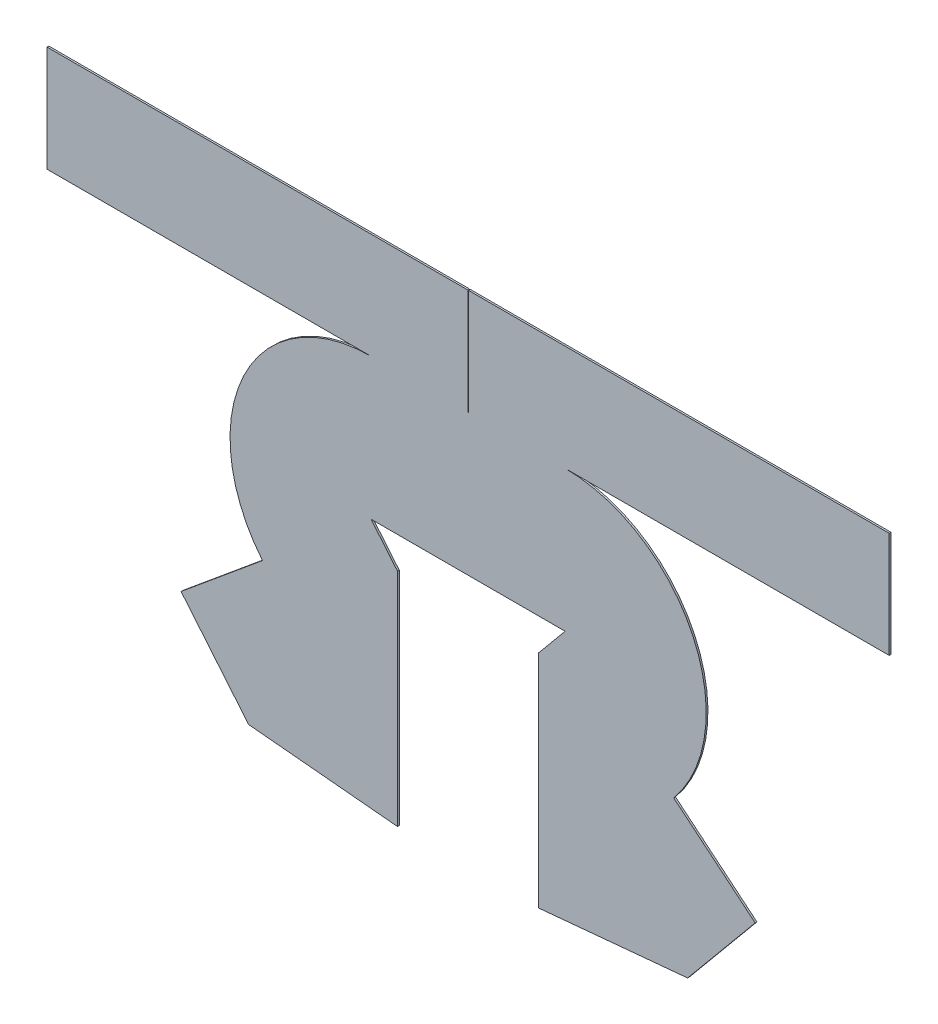
from build123d import *

# Parameters (mm, degrees)
BOSS_EXTRUDE2_DEPTH = 2.54
SKETCH2_W           = 0.79375
SKETCH2_H           = 152.4
CUT_EXTRUDE1_DEPTH  = 55.525399461


with BuildPart() as part:
    # Sketch1 → Boss-Extrude2 (new body)
    with BuildSketch(Plane.XY):
        with BuildLine():
            ThreePointArc((437.202610799, 39.476614679), (464.676131123, 255.58711032), (280.770009641, 372.365015451))
            Line((280.770009641, 372.365015451), (747.609563641, 372.365015451))
            Line((747.609563641, 372.365015451), (747.609563641, 524.765015451))
            Line((747.609563641, 524.765015451), (-465.469544359, 524.765015451))
            Line((-465.469544359, 524.765015451), (-465.469544359, 372.365015451))
            Line((-465.469544359, 372.365015451), (1.370009641, 372.365015451))
            ThreePointArc((1.370009641, 372.365015451), (-182.536111841, 255.58711032), (-155.062591517, 39.476614679))
            Line((-155.062591517, 39.476614679), (-272.387042386, -57.7896859))
            Line((-272.387042386, -57.7896859), (-175.120741807, -175.114136769))
            Line((-175.120741807, -175.114136769), (39.470009641, -195.172287059))
            Line((39.470009641, -195.172287059), (39.470009641, 123.208075057))
            Line((39.470009641, 123.208075057), (1.370009641, 169.165015451))
            Line((1.370009641, 169.165015451), (280.770009641, 169.165015451))
            Line((280.770009641, 169.165015451), (242.670009641, 123.208075057))
            Line((242.670009641, 123.208075057), (242.670009641, -195.172287059))
            Line((242.670009641, -195.172287059), (457.260761089, -175.114136769))
            Line((457.260761089, -175.114136769), (554.527061668, -57.7896859))
            Line((554.527061668, -57.7896859), (437.202610799, 39.476614679))
        make_face()
    extrude(amount=BOSS_EXTRUDE2_DEPTH)

    # Sketch2 → Cut-Extrude1 (cut)
    with BuildSketch(Plane.XY.offset(2.54)):
        with Locations((141.070009641, 448.565015451)):
            Rectangle(SKETCH2_W, SKETCH2_H)
    extrude(amount=-CUT_EXTRUDE1_DEPTH, mode=Mode.SUBTRACT)


solid = part.part
